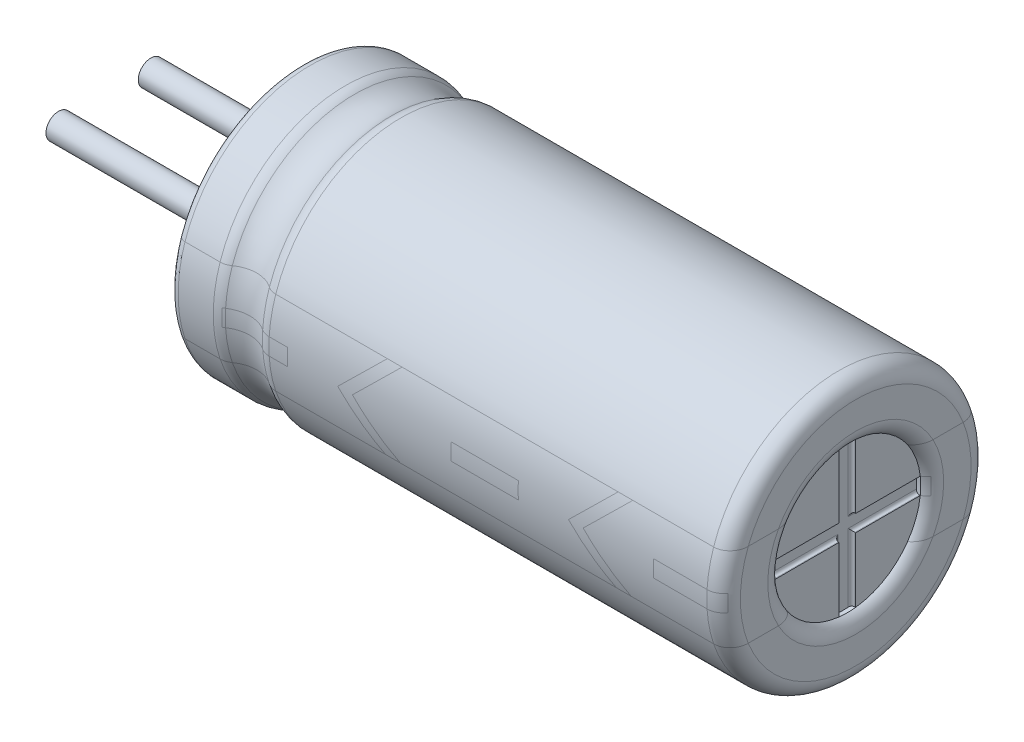
from build123d import *

# Parameters (mm, degrees)
FILLET_1_R          = 0.4
SKETCH_2_R          = 1.75
CUT_EXTRUDE_1_DEPTH = 0.2
FILLET_2_R          = 0.4
FILLET_3_R          = 0.4
CUT_EXTRUDE_2_DEPTH = 0.1
SKETCH_5_R          = 2.5
CUT_EXTRUDE_3_DEPTH = 0.3
FILLET_6_R          = 0.2
SKETCH_6_R          = 0.3
EXTRUDE_1_DEPTH     = 5
FILLET_7_R          = 0.08


with BuildPart() as part:
    # Эскиз1 → Повернуть1 (revolve)
    with BuildSketch(Plane(origin=(0, 0, 0), x_dir=(1, 0, 0), z_dir=(0, 1, 0)), mode=Mode.PRIVATE) as revolve_1_sk:
        with BuildLine():
            Line((0, 0), (0, 3.15))
            Line((0, 3.15), (1.170849738, 3.15))
            ThreePointArc((1.170849738, 3.15), (1.7, 2.95), (2.229150262, 3.15))
            Line((2.229150262, 3.15), (13.2, 3.15))
            Line((13.2, 3.15), (13.2, 0))
            Line((13.2, 0), (0, 0))
        make_face()
    revolve(revolve_1_sk.sketch.rotate(Axis((-17.233728413, 0, 0), (1, 0, 0)), 180), axis=Axis((-17.233728413, 0, 0), (1, 0, 0)))

    # Скругление1
    fillet_1_edges = [part.edges().sort_by_distance(p)[0] for p in [
        (1.170849738, 0, -3.15),
        (2.229150262, 0, -3.15),
    ]]
    fillet(fillet_1_edges, radius=FILLET_1_R)

    # Эскиз2 → Вырез-Вытянуть1 (cut)
    with BuildSketch(Plane(origin=(13.2, 0, 0), x_dir=(0, 0, -1), z_dir=(1, 0, 0))):
        Circle(SKETCH_2_R)
    extrude(amount=-CUT_EXTRUDE_1_DEPTH, mode=Mode.SUBTRACT)

    # Скругление2
    # the kernel refuses this fillet: 0.4 mm, written as the material it takes off along each edge
    with BuildSketch(Plane(origin=(13.2, 0, 0), x_dir=(0, 0, -1), z_dir=(0, -1, 0))) as fillet_2_piece_1:
        with BuildLine():
            CenterArc((2.096410162, -0.4), FILLET_2_R, 90, 60)
            Line((1.75, -0.2), (1.743071797, -0.196))
            ThreePointArc((1.743071797, -0.196), (1.742, -0.1), (1.742, 0))
            Line((1.742, 0), (1.75, 0.008))
            Line((1.75, 0.008), (2.096410162, 0.008))
            Line((2.096410162, 0.008), (2.096410162, 0))
        make_face()
    revolve(axis=Axis((13.2, 0, 0), (1, 0, 0)), mode=Mode.SUBTRACT)

    # Скругление3
    fillet_3_edges = [part.edges().sort_by_distance(p)[0] for p in [
        (13.2, 0, -3.15),
    ]]
    fillet(fillet_3_edges, radius=FILLET_3_R)

    # Эскиз3 → Вырез-Вытянуть2 (cut)
    with BuildSketch(Plane(origin=(13, 0, 0), x_dir=(0, 0, -1), z_dir=(1, 0, 0))):
        with BuildLine():
            Line((-0.2, 1.738533865), (-0.2, 0.2))
            Line((-0.2, 0.2), (-1.738533865, 0.2))
            ThreePointArc((-1.738533865, 0.2), (-1.75, 0), (-1.738533865, -0.2))
            Line((-1.738533865, -0.2), (-0.2, -0.2))
            Line((-0.2, -0.2), (-0.2, -1.738533865))
            ThreePointArc((-0.2, -1.738533865), (0, -1.75), (0.2, -1.738533865))
            Line((0.2, -1.738533865), (0.2, -0.2))
            Line((0.2, -0.2), (1.738533865, -0.2))
            ThreePointArc((1.738533865, -0.2), (1.75, 0), (1.738533865, 0.2))
            Line((1.738533865, 0.2), (0.2, 0.2))
            Line((0.2, 0.2), (0.2, 1.738533865))
            ThreePointArc((0.2, 1.738533865), (0, 1.75), (-0.2, 1.738533865))
        make_face()
    extrude(amount=-CUT_EXTRUDE_2_DEPTH, mode=Mode.SUBTRACT)

    # Эскиз5 → Вырез-Вытянуть3 (cut)
    with BuildSketch(Plane.ZY):
        Circle(SKETCH_5_R)
    extrude(amount=-CUT_EXTRUDE_3_DEPTH, mode=Mode.SUBTRACT)

    # Скругление6
    fillet_6_edges = [part.edges().sort_by_distance(p)[0] for p in [
        (0, 0, -3.15),
        (0, 0, -2.5),
    ]]
    fillet(fillet_6_edges, radius=FILLET_6_R)

    # Эскиз6 → Бобышка-Вытянуть1 (add)
    with BuildSketch(Plane.ZY.offset(-0.3)):
        with Locations((-1.1, 0)):
            Circle(SKETCH_6_R)
        with Locations(Location((1.1, 0, 0), (0, 0, 180))):
            Circle(SKETCH_6_R)
    extrude(amount=EXTRUDE_1_DEPTH)

    # Скругление7
    fillet_7_edges = [part.edges().sort_by_distance(p)[0] for p in [
        (12.9, 0.969266933, -0.2),
        (12.9, 0.2, -0.969266933),
        (12.9, -0.2, -0.969266933),
        (12.9, -0.969266933, -0.2),
        (12.9, -0.969266933, 0.2),
        (12.9, -0.2, 0.969266933),
        (12.9, 0.2, 0.969266933),
        (12.9, 0.969266933, 0.2),
    ]]
    fillet(fillet_7_edges, radius=FILLET_7_R)


solid = part.part
